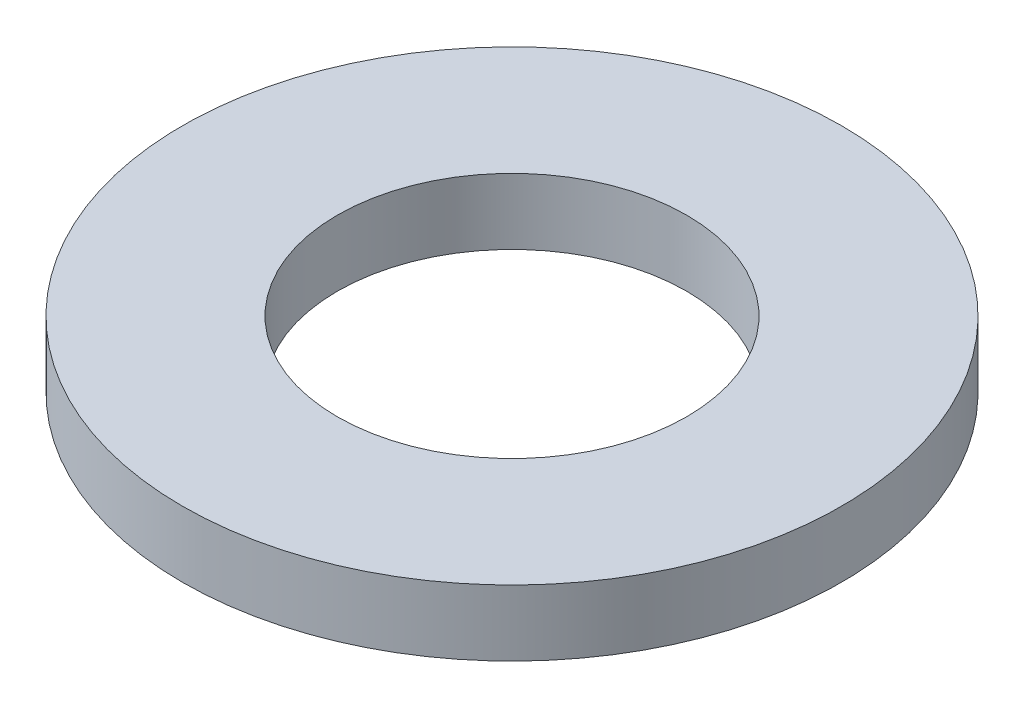
from build123d import *

# Parameters (mm, degrees)
ESQUISSE1_W = 2.35
ESQUISSE1_H = 1


with BuildPart() as part:
    # Esquisse1 → Base-Révolution (revolve)
    with BuildSketch(Plane.XY):
        with Locations((3.825, 0.5)):
            Rectangle(ESQUISSE1_W, ESQUISSE1_H)
    revolve(axis=Axis((0, 0, 0), (0, 1, 0)))


solid = part.part
